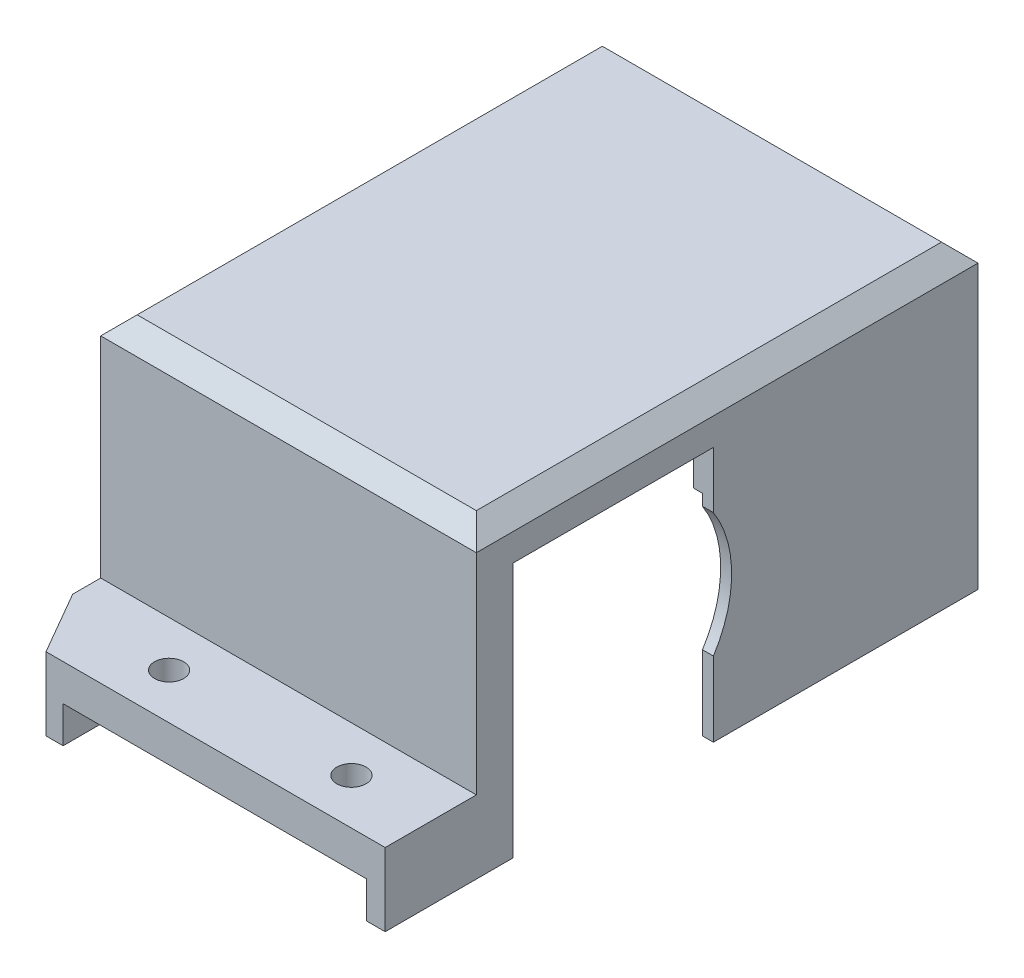
from build123d import *

# Parameters (mm, degrees)
SKETCH1_W                = 39
SKETCH1_H                = 49.22
BOSS_EXTRUDE2_DEPTH      = 30
SKETCH3_W                = 1.75
SKETCH3_H                = 20
SKETCH3_W_2              = 1
SKETCH3_H_2              = 15.1
CUT_EXTRUDE3_DEPTH       = 47.22
CUT_EXTRUDE4_DEPTH       = 47.22
CUT_EXTRUDE5_DEPTH       = 3.75
SKETCH9_W                = 22.2
SKETCH9_H                = 30
CUT_EXTRUDE7_DEPTH       = 61.922592565
SKETCH11_W               = 0.8
SKETCH11_H               = 21.811754546
SKETCH11_H_2             = 8.188245454
CUT_EXTRUDE8_DEPTH       = 46.008146799
SKETCH12_W               = 23
SKETCH12_H               = 2.5
BOSS_EXTRUDE3_DEPTH      = 3
SKETCH13_W               = 23
SKETCH13_H               = 2.5
BOSS_EXTRUDE4_DEPTH      = 3
BOSS_EXTRUDE5_REACH      = 51.909
SKETCH14_W               = 27.02
SKETCH14_H               = 3
SKETCH15_W               = 30.25
SKETCH15_H               = 3
CUT_EXTRUDE9_DEPTH       = 25.02
SKETCH16_W               = 30.25
SKETCH16_H               = 3
CUT_EXTRUDE10_DEPTH      = 46.276919382
SKETCH24_W               = 23
SKETCH24_H               = 2.5
BOSS_EXTRUDE8_DEPTH      = 6
BOSS_EXTRUDE9_DEPTH      = 3
SKETCH26_W               = 41.2
SKETCH26_H               = 27.02
BOSS_EXTRUDE10_DEPTH     = 3
SKETCH29_W               = 4.264424859
SKETCH29_H               = 26.447816837
CUT_EXTRUDE14_DEPTH      = 41.905994632
SKETCH30_W               = 3.981396999
SKETCH30_H               = 33.655588154
CUT_EXTRUDE15_DEPTH      = 40.425282457
BOSS_EXTRUDE15_DEPTH     = 2
BOSS_EXTRUDE16_DEPTH     = 2
SKETCH36_W               = 41.2
SKETCH36_H               = 4.993514727
BOSS_EXTRUDE17_DEPTH     = 26
SKETCH37_W               = 41.2
SKETCH37_H               = 5
BOSS_EXTRUDE18_DEPTH     = 28.006485273
SKETCH38_W               = 41.2
SKETCH38_H               = 5
BOSS_EXTRUDE19_DEPTH     = 20
BOSS_EXTRUDE21_DEPTH     = 5
SKETCH40_R               = 2
CUT_EXTRUDE16_DEPTH      = 78.060934741
BOSS_EXTRUDE22_DEPTH     = 10
SKETCH42_W               = 33.25
SKETCH42_H               = 4
CUT_EXTRUDE17_DEPTH      = 89.632791503
SKETCH43_W               = 30
SKETCH43_H               = 5
CUT_EXTRUDE19_DEPTH      = 10
SKETCH44_W               = 20
SKETCH44_H               = 4.5
BOSS_EXTRUDE23_DEPTH     = 6
SKETCH45_W               = 41.2
SKETCH45_H               = 15
CUT_EXTRUDE20_DEPTH      = 3
SKETCH46_W               = 41.2
SKETCH46_H               = 16.207061994
CUT_EXTRUDE21_DEPTH      = 80.015110347
SKETCH47_W               = 41.2
SKETCH47_H               = 10
BOSS_EXTRUDE24_DEPTH     = 3
SKETCH48_W               = 6
SKETCH48_H               = 25
SKETCH48_W_2             = 3
CUT_EXTRUDE22_DEPTH      = 66.095752287
SKETCH50_W               = 33.25
SKETCH50_H               = 1
CUT_EXTRUDE23_DEPTH      = 69.929234935
SKETCH51_W               = 5.875
SKETCH51_H               = 15
SKETCH51_W_2             = 2.075
BOSS_EXTRUDE25_DEPTH     = 3
CUT_EXTRUDE24_DEPTH      = 10
CUT_EXTRUDE24_DEPTH_BACK = 62.947676833
SKETCH54_W               = 41.2
SKETCH54_H               = 1
CUT_EXTRUDE25_DEPTH      = 28.006485273
CHAMFER1_SIZE            = 2
CUT_EXTRUDE28_DEPTH      = 61.179021802


with BuildPart() as part:
    # Sketch1 → Boss-Extrude2 (new body)
    with BuildSketch(Plane(origin=(0, 0, 0), x_dir=(1, 0, 0), z_dir=(0, 1, 0))):
        with Locations((-0.391025069, -11.314396792)):
            Rectangle(SKETCH1_W, SKETCH1_H)
    extrude(amount=BOSS_EXTRUDE2_DEPTH)

    # Sketch3 → Cut-Extrude3 (cut)
    with BuildSketch(Plane.XY.offset(35.924396792)):
        Polygon((16.108974931, 23.05), (16.108974931, 28), (-16.141025069, 28), (-16.141025069, 25.5), (-16.141025069, 5.5), (-16.141025069, 0), (16.108974931, 0), (16.108974931, 7.95), align=None)
        with Locations((-17.016025069, 15.5)):
            Rectangle(SKETCH3_W, SKETCH3_H)
        with Locations((16.608974931, 15.5)):
            Rectangle(SKETCH3_W_2, SKETCH3_H_2)
    extrude(amount=-CUT_EXTRUDE3_DEPTH, mode=Mode.SUBTRACT)

    # Sketch7 → Cut-Extrude4 (cut)
    with BuildSketch(Plane.ZY.offset(19.891025069)):
        with BuildLine():
            ThreePointArc((11.724396792, 15), (24.324396792, 2.4), (36.924396792, 15))
            ThreePointArc((36.924396792, 15), (24.324396792, 27.6), (11.724396792, 15))
        make_face()
    extrude(amount=-CUT_EXTRUDE4_DEPTH, mode=Mode.SUBTRACT)

    # Sketch8 → Cut-Extrude5 (cut)
    with BuildSketch(Plane.ZY.offset(19.891025069)):
        with BuildLine():
            Line((35.924396792, 30), (17.633933867, 30))
            Line((17.633933867, 30), (17.633933867, 27))
            Line((17.633933867, 27), (8.633933867, 27))
            Line((8.633933867, 27), (8.633933867, 4))
            Line((8.633933867, 4), (17.633933867, 4))
            Line((17.633933867, 4), (17.633933867, 0))
            Line((17.633933867, 0), (35.924396792, 0))
            Line((35.924396792, 0), (35.924396792, 10.08065045))
            ThreePointArc((35.924396792, 10.08065045), (11.724396792, 15), (35.924396792, 19.91934955))
            Line((35.924396792, 19.91934955), (35.924396792, 30))
        make_face()
    extrude(amount=-CUT_EXTRUDE5_DEPTH, mode=Mode.SUBTRACT)

    # Sketch9 → Cut-Extrude7 (cut, through all)
    with BuildSketch(Plane(origin=(19.108974931, 0, 0), x_dir=(0, 0, -1), z_dir=(1, 0, 0))):
        with Locations((-24.824396792, 15)):
            Rectangle(SKETCH9_W, SKETCH9_H)
    extrude(amount=-CUT_EXTRUDE7_DEPTH, mode=Mode.SUBTRACT)

    # Sketch11 → Cut-Extrude8 (cut, through all)
    with BuildSketch(Plane.XY.offset(13.724396792)):
        with Locations((18.708974931, 19.094122727)):
            Rectangle(SKETCH11_W, SKETCH11_H)
        with Locations((18.708974931, 4.094122727)):
            Rectangle(SKETCH11_W, SKETCH11_H_2)
    extrude(amount=-CUT_EXTRUDE8_DEPTH, mode=Mode.SUBTRACT)

    # Sketch12 → Boss-Extrude3 (add)
    with BuildSketch(Plane(origin=(18.308974931, 0, 0), x_dir=(0, 0, -1), z_dir=(1, 0, 0))):
        with Locations((1.795603208, 1.25)):
            Rectangle(SKETCH12_W, SKETCH12_H)
    extrude(amount=BOSS_EXTRUDE3_DEPTH)

    # Sketch13 → Boss-Extrude4 (add)
    with BuildSketch(Plane.ZY.offset(19.891025069)):
        with Locations((-1.795603208, 1.25)):
            Rectangle(SKETCH13_W, SKETCH13_H)
    extrude(amount=BOSS_EXTRUDE4_DEPTH)

    # Sketch14 → Boss-Extrude5 (add, up to next)
    with BuildSketch(Plane(origin=(-16.141025069, 0, 0), x_dir=(0, 0, -1), z_dir=(1, 0, 0)), mode=Mode.PRIVATE) as boss_extrude5_sk1:
        with Locations((-0.214396792, 1.5)):
            Rectangle(SKETCH14_W, SKETCH14_H)
    boss_extrude5_tool1 = extrude(boss_extrude5_sk1.sketch, amount=BOSS_EXTRUDE5_REACH, mode=Mode.PRIVATE) - part.part
    add(boss_extrude5_tool1.solids().sort_by_distance((-16.141025, 1.5, 0.214397))[0])

    # Sketch15 → Cut-Extrude9 (cut)
    with BuildSketch(Plane.XY.offset(13.724396792)):
        with Locations((-0.016025069, 1.5)):
            Rectangle(SKETCH15_W, SKETCH15_H)
    extrude(amount=-CUT_EXTRUDE9_DEPTH, mode=Mode.SUBTRACT)

    # Sketch16 → Cut-Extrude10 (cut, through all)
    with BuildSketch(Plane.XY.offset(-11.295603208)):
        with Locations((-0.016025069, 1.5)):
            Rectangle(SKETCH16_W, SKETCH16_H)
    extrude(amount=-CUT_EXTRUDE10_DEPTH, mode=Mode.SUBTRACT)

    # Sketch24 → Boss-Extrude8 (add)
    with BuildSketch(Plane.ZY.offset(22.891025069)):
        with Locations((-1.795603208, 1.25)):
            Rectangle(SKETCH24_W, SKETCH24_H)
    extrude(amount=BOSS_EXTRUDE8_DEPTH)

    # Sketch25 → Boss-Extrude9 (add)
    with BuildSketch(Plane.ZY.offset(19.891025069)):
        Polygon((-13.295603208, 30), (13.724396792, 30), (13.724396792, 27), (8.633933867, 27), (8.633933867, 4), (13.724396792, 4), (13.724396792, 0), (9.704396792, 0), (9.704396792, 2.5), (-13.295603208, 2.5), align=None)
    extrude(amount=BOSS_EXTRUDE9_DEPTH)

    # Sketch26 → Boss-Extrude10 (add)
    with BuildSketch(Plane(origin=(0, 30, 0), x_dir=(1, 0, 0), z_dir=(0, 1, 0))):
        with Locations((-2.291025069, -0.214396792)):
            Rectangle(SKETCH26_W, SKETCH26_H)
    extrude(amount=BOSS_EXTRUDE10_DEPTH)

    # Sketch29 → Cut-Extrude14 (cut, through all)
    with BuildSketch(Plane.XZ.offset(-25.5)):
        with Locations((-15.75881264, 1.92830521)):
            Rectangle(SKETCH29_W, SKETCH29_H)
    extrude(amount=CUT_EXTRUDE14_DEPTH, mode=Mode.SUBTRACT)

    # Sketch30 → Cut-Extrude15 (cut, through all)
    with BuildSketch(Plane(origin=(0, 23.05, 0), x_dir=(-1, 0, 0), z_dir=(0, -1, 0))):
        with Locations((-15.118276432, -5.532190869)):
            Rectangle(SKETCH30_W, SKETCH30_H)
    extrude(amount=CUT_EXTRUDE15_DEPTH, mode=Mode.SUBTRACT)

    # Sketch34 → Boss-Extrude15 (add)
    with BuildSketch(Plane(origin=(0, 0, -13.295603208), x_dir=(-1, 0, 0), z_dir=(0, 0, -1))):
        Polygon((-18.308974931, 33), (-18.308974931, 2.5), (-21.308974931, 2.5), (-21.308974931, 0), (28.891025069, 0), (28.891025069, 2.5), (22.891025069, 2.5), (22.891025069, 33), align=None)
    extrude(amount=-BOSS_EXTRUDE15_DEPTH)

    # Sketch35 → Boss-Extrude16 (add)
    with BuildSketch(Plane(origin=(0, 0, -13.295603208), x_dir=(-1, 0, 0), z_dir=(0, 0, -1))):
        Polygon((-18.308974931, 33), (-18.308974931, 2.5), (-21.308974931, 2.5), (-21.308974931, 0), (28.891025069, 0), (28.891025069, 2.5), (22.891025069, 2.5), (22.891025069, 33), align=None)
    extrude(amount=BOSS_EXTRUDE16_DEPTH)

    # Sketch36 → Boss-Extrude17 (add)
    with BuildSketch(Plane.XY.offset(13.724396792)):
        with Locations((-2.291025069, 30.503242637)):
            Rectangle(SKETCH36_W, SKETCH36_H)
    extrude(amount=BOSS_EXTRUDE17_DEPTH)

    # Sketch37 → Boss-Extrude18 (add)
    with BuildSketch(Plane(origin=(0, 28.006485273, 0), x_dir=(-1, 0, 0), z_dir=(0, -1, 0))):
        with Locations((2.291025069, -37.224396792)):
            Rectangle(SKETCH37_W, SKETCH37_H)
    extrude(amount=BOSS_EXTRUDE18_DEPTH)

    # Sketch38 → Boss-Extrude19 (add)
    with BuildSketch(Plane.XY.offset(39.724396792)):
        with Locations((-2.291025069, 2.5)):
            Rectangle(SKETCH38_W, SKETCH38_H)
    extrude(amount=BOSS_EXTRUDE19_DEPTH)

    # Sketch39 → Boss-Extrude21 (add)
    with BuildSketch(Plane(origin=(0, 5, 0), x_dir=(1, 0, 0), z_dir=(0, 1, 0))):
        with BuildLine():
            Line((-8.291025069, -59.724396792), (-22.891025069, -59.724396792))
            Line((-22.891025069, -59.724396792), (-4.038597885, -65.464256481))
            ThreePointArc((-4.038597885, -65.464256481), (-7.112095329, -63.296130482), (-8.291025069, -59.724396792))
        make_face()
        with BuildLine():
            ThreePointArc((-8.291025069, -59.724396792), (-7.112095329, -63.296130482), (-4.038597885, -65.464256481))
            ThreePointArc((-4.038597885, -65.464256481), (-2.291025069, -65.724396792), (-0.543452254, -65.464256481))
            ThreePointArc((-0.543452254, -65.464256481), (2.53004519, -63.296130482), (3.708974931, -59.724396792))
            Line((3.708974931, -59.724396792), (-0.291025069, -59.724396792))
            ThreePointArc((-0.291025069, -59.724396792), (-2.291025069, -61.724396792), (-4.291025069, -59.724396792))
            Line((-4.291025069, -59.724396792), (-8.291025069, -59.724396792))
        make_face()
        with BuildLine():
            ThreePointArc((3.708974931, -59.724396792), (-2.291025069, -53.724396792), (-8.291025069, -59.724396792))
            Line((-8.291025069, -59.724396792), (-4.291025069, -59.724396792))
            ThreePointArc((-4.291025069, -59.724396792), (-2.291025069, -57.724396792), (-0.291025069, -59.724396792))
            Line((-0.291025069, -59.724396792), (3.708974931, -59.724396792))
        make_face()
        with BuildLine():
            ThreePointArc((3.708974931, -59.724396792), (2.53004519, -63.296130482), (-0.543452254, -65.464256481))
            Line((-0.543452254, -65.464256481), (18.308974931, -59.724396792))
            Line((18.308974931, -59.724396792), (3.708974931, -59.724396792))
        make_face()
    extrude(amount=-BOSS_EXTRUDE21_DEPTH)

    # Sketch40 → Cut-Extrude16 (cut, through all)
    with BuildSketch(Plane(origin=(0, 5, 0), x_dir=(1, 0, 0), z_dir=(0, 1, 0))):
        with Locations(Location((-2.291025069, -59.724396792, 0), (0, 0, 270))):
            Circle(SKETCH40_R)
    extrude(amount=-CUT_EXTRUDE16_DEPTH, mode=Mode.SUBTRACT)

    # Fillet1
    # the kernel refuses this chamfer: 2 mm, written as the material it takes off along each edge
    with BuildSketch(Plane(origin=(-22.891025069, 33, -20.438969184), x_dir=(-0.027495876610585647, -0.9996219169112968, 0), z_dir=(0, 0, 1))) as fillet1_piece_1:
        with BuildLine():
            Line((2.05734639, 0), (-0.11309431, 2.054235587))
            Line((-0.11309431, 2.054235587), (-0.153079186, 2.053135752))
            ThreePointArc((-0.153079186, 2.053135752), (-0.068258454, 1.026795659), (-0.039984877, -0.001099835))
            Line((-0.039984877, -0.001099835), (0.001099835, -0.039984877))
            ThreePointArc((0.001099835, -0.039984877), (1.028995329, -0.011711299), (2.058446225, -0.039984877))
            Line((2.058446225, -0.039984877), (2.05734639, 0))
        make_face()
    extrude(amount=65.306731952, mode=Mode.SUBTRACT)
    with BuildSketch(Plane(origin=(18.308974931, 33, -20.438969184), x_dir=(0.027495876610585647, -0.9996219169112968, 0), z_dir=(0, 0, 1))) as fillet1_piece_2:
        with BuildLine():
            Line((2.05734639, 0), (-0.11309431, -2.054235587))
            Line((-0.11309431, -2.054235587), (-0.153079186, -2.053135752))
            ThreePointArc((-0.153079186, -2.053135752), (-0.068258454, -1.026795659), (-0.039984877, 0.001099835))
            Line((-0.039984877, 0.001099835), (0.001099835, 0.039984877))
            ThreePointArc((0.001099835, 0.039984877), (1.028995329, 0.011711299), (2.058446225, 0.039984877))
            Line((2.058446225, 0.039984877), (2.05734639, 0))
        make_face()
    extrude(amount=65.306731952, mode=Mode.SUBTRACT)
    with BuildSketch(Plane(origin=(-28.034391045, 33, -15.295603208), x_dir=(0, -0.9996219169112968, -0.02749587661058651), z_dir=(1, 0, 0)), Plane(origin=(-28.034391045, 33, 39.724396792), x_dir=(0, 0.027495876610585647, -0.9996219169112968), z_dir=(1, 0, 0))) as fillet1_piece_3:
        with BuildLine():
            Line((2.05734639, 0), (-0.11309431, -2.054235587))
            Line((-0.11309431, -2.054235587), (-0.153079186, -2.053135752))
            ThreePointArc((-0.153079186, -2.053135752), (-0.068258454, -1.026795659), (-0.039984877, 0.001099835))
            Line((-0.039984877, 0.001099835), (0.001099835, 0.039984877))
            ThreePointArc((0.001099835, 0.039984877), (1.028995329, 0.011711299), (2.058446225, 0.039984877))
            Line((2.058446225, 0.039984877), (2.05734639, 0))
        make_face()
    extrude(amount=51.486731952, mode=Mode.SUBTRACT)
    with BuildSketch(Plane(origin=(-22.891025069, 8.866831055, 59.724396792), x_dir=(-0.030789498682027062, 0, -0.9995258909957808), z_dir=(0, -1, 0)), Plane(origin=(18.308974931, -3.866831055, 59.724396792), x_dir=(0.030789498682027062, 0, -0.9995258909957808), z_dir=(0, 1, 0))) as fillet1_piece_4:
        with BuildLine():
            Line((1.546732422, 0), (-0.540723907, 1.449137275))
            Line((-0.540723907, 1.449137275), (-0.578612783, 1.436314131))
            ThreePointArc((-0.578612783, 1.436314131), (-0.285696, 0.719378969), (-0.037888877, -0.012823145))
            Line((-0.037888877, -0.012823145), (0.00123158, -0.039981036))
            ThreePointArc((0.00123158, -0.039981036), (0.773864645, -0.016180767), (1.547964002, -0.039981036))
            Line((1.547964002, -0.039981036), (1.546732422, 0))
        make_face()
    extrude(amount=12.73366211, mode=Mode.SUBTRACT)

    # Sketch41 → Boss-Extrude22 (add)
    with BuildSketch(Plane(origin=(0, 0, -15.295603208), x_dir=(-1, 0, 0), z_dir=(0, 0, -1))):
        Polygon((17.291025069, 5), (2.291025069, 5), (-12.708974931, 5), (-12.708974931, 0), (2.291025069, 0), (17.291025069, 0), align=None)
    extrude(amount=BOSS_EXTRUDE22_DEPTH)

    # Sketch42 → Cut-Extrude17 (cut, through all)
    with BuildSketch(Plane.XY.offset(-11.295603208)):
        with Locations((-0.391025069, 2)):
            Rectangle(SKETCH42_W, SKETCH42_H)
    extrude(amount=-CUT_EXTRUDE17_DEPTH, mode=Mode.SUBTRACT)

    # Sketch43 → Cut-Extrude19 (cut)
    with BuildSketch(Plane(origin=(0, 0, -25.295603208), x_dir=(-1, 0, 0), z_dir=(0, 0, -1))):
        with Locations((2.291025069, 2.5)):
            Rectangle(SKETCH43_W, SKETCH43_H)
    extrude(amount=-CUT_EXTRUDE19_DEPTH, mode=Mode.SUBTRACT)

    # Sketch44 → Boss-Extrude23 (add)
    with BuildSketch(Plane(origin=(0, 0, -15.295603208), x_dir=(-1, 0, 0), z_dir=(0, 0, -1))):
        with Locations((0.391025069, 6.25)):
            Rectangle(SKETCH44_W, SKETCH44_H)
    extrude(amount=BOSS_EXTRUDE23_DEPTH)

    # Sketch45 → Cut-Extrude20 (cut)
    with BuildSketch(Plane(origin=(0, 0, 0), x_dir=(-1, 0, 0), z_dir=(0, -1, 0))):
        with Locations((2.291025069, -42.224396792)):
            Rectangle(SKETCH45_W, SKETCH45_H)
    extrude(amount=-CUT_EXTRUDE20_DEPTH, mode=Mode.SUBTRACT)

    # Sketch46 → Cut-Extrude21 (cut, through all)
    with BuildSketch(Plane(origin=(0, 0, 0), x_dir=(-1, 0, 0), z_dir=(0, -1, 0))):
        with Locations((2.291025069, -57.827927789)):
            Rectangle(SKETCH46_W, SKETCH46_H)
    extrude(amount=-CUT_EXTRUDE21_DEPTH, mode=Mode.SUBTRACT)

    # Sketch47 → Boss-Extrude24 (add)
    with BuildSketch(Plane(origin=(0, 5, 0), x_dir=(1, 0, 0), z_dir=(0, 1, 0))):
        with Locations((-2.291025069, -44.724396792)):
            Rectangle(SKETCH47_W, SKETCH47_H)
    extrude(amount=BOSS_EXTRUDE24_DEPTH)

    # Sketch48 → Cut-Extrude22 (cut, through all)
    with BuildSketch(Plane(origin=(0, 2.5, 0), x_dir=(1, 0, 0), z_dir=(0, 1, 0))):
        with Locations((-25.891025069, 2.795603208)):
            Rectangle(SKETCH48_W, SKETCH48_H)
        with Locations((19.808974931, 2.795603208)):
            Rectangle(SKETCH48_W_2, SKETCH48_H)
    extrude(amount=-CUT_EXTRUDE22_DEPTH, mode=Mode.SUBTRACT)

    # Sketch50 → Cut-Extrude23 (cut, through all)
    with BuildSketch(Plane(origin=(0, 0, 34.724396792), x_dir=(-1, 0, 0), z_dir=(0, 0, -1))):
        with Locations((0.391025069, 3.5)):
            Rectangle(SKETCH50_W, SKETCH50_H)
    extrude(amount=-CUT_EXTRUDE23_DEPTH, mode=Mode.SUBTRACT)

    # Sketch51 → Boss-Extrude25 (add)
    with BuildSketch(Plane.XZ.offset(-3)):
        with Locations((-19.953525069, 42.224396792)):
            Rectangle(SKETCH51_W, SKETCH51_H)
        with Locations((17.271474931, 42.224396792)):
            Rectangle(SKETCH51_W_2, SKETCH51_H)
    extrude(amount=BOSS_EXTRUDE25_DEPTH)

    # Sketch52 → Cut-Extrude24 (cut, two sides: drawn at the far end of the back side and taken through both)
    with BuildSketch(Plane(origin=(0, 4, 0), x_dir=(-1, 0, 0), z_dir=(0, -1, 0)).offset(-CUT_EXTRUDE24_DEPTH_BACK)):
        with BuildLine():
            ThreePointArc((8.791025069, -44.724396792), (9.259654219, -45.855767642), (10.391025069, -46.324396792))
            Line((10.391025069, -46.324396792), (10.391025069, -44.724396792))
            Line((10.391025069, -44.724396792), (8.791025069, -44.724396792))
        make_face()
        with BuildLine():
            Line((10.391025069, -44.724396792), (10.391025069, -46.324396792))
            ThreePointArc((10.391025069, -46.324396792), (11.522395919, -45.855767642), (11.991025069, -44.724396792))
            ThreePointArc((11.991025069, -44.724396792), (10.391025069, -43.124396792), (8.791025069, -44.724396792))
            Line((8.791025069, -44.724396792), (10.391025069, -44.724396792))
        make_face()
        with BuildLine():
            ThreePointArc((-8.008974931, -44.724396792), (-10.740345781, -43.593025942), (-9.608974931, -46.324396792))
            Line((-9.608974931, -46.324396792), (-9.608974931, -44.724396792))
            Line((-9.608974931, -44.724396792), (-8.008974931, -44.724396792))
        make_face()
        with BuildLine():
            Line((-9.608974931, -44.724396792), (-9.608974931, -46.324396792))
            ThreePointArc((-9.608974931, -46.324396792), (-8.477604081, -45.855767642), (-8.008974931, -44.724396792))
            Line((-8.008974931, -44.724396792), (-9.608974931, -44.724396792))
        make_face()
    extrude(amount=CUT_EXTRUDE24_DEPTH + CUT_EXTRUDE24_DEPTH_BACK, mode=Mode.SUBTRACT)

    # Sketch54 → Cut-Extrude25 (cut)
    with BuildSketch(Plane(origin=(0, 0, 0), x_dir=(-1, 0, 0), z_dir=(0, -1, 0))):
        with Locations((2.291025069, -35.224396792)):
            Rectangle(SKETCH54_W, SKETCH54_H)
    extrude(amount=-CUT_EXTRUDE25_DEPTH, mode=Mode.SUBTRACT)

    # Chamfer1
    chamfer1_edges = [part.edges().sort_by_distance(p)[0] for p in [
        (-22.891025069, 15.5, -15.295603208),
    ]]
    chamfer(chamfer1_edges, length=CHAMFER1_SIZE)

    # Sketch55 → Cut-Extrude28 (cut, through all)
    with BuildSketch(Plane(origin=(0, 8, 0), x_dir=(1, 0, 0), z_dir=(0, 1, 0))):
        Polygon((-22.891025069, -42.796193562), (-22.891025069, -49.724396792), (-18.891025069, -49.724396792), align=None)
    extrude(amount=-CUT_EXTRUDE28_DEPTH, mode=Mode.SUBTRACT)


solid = part.part
